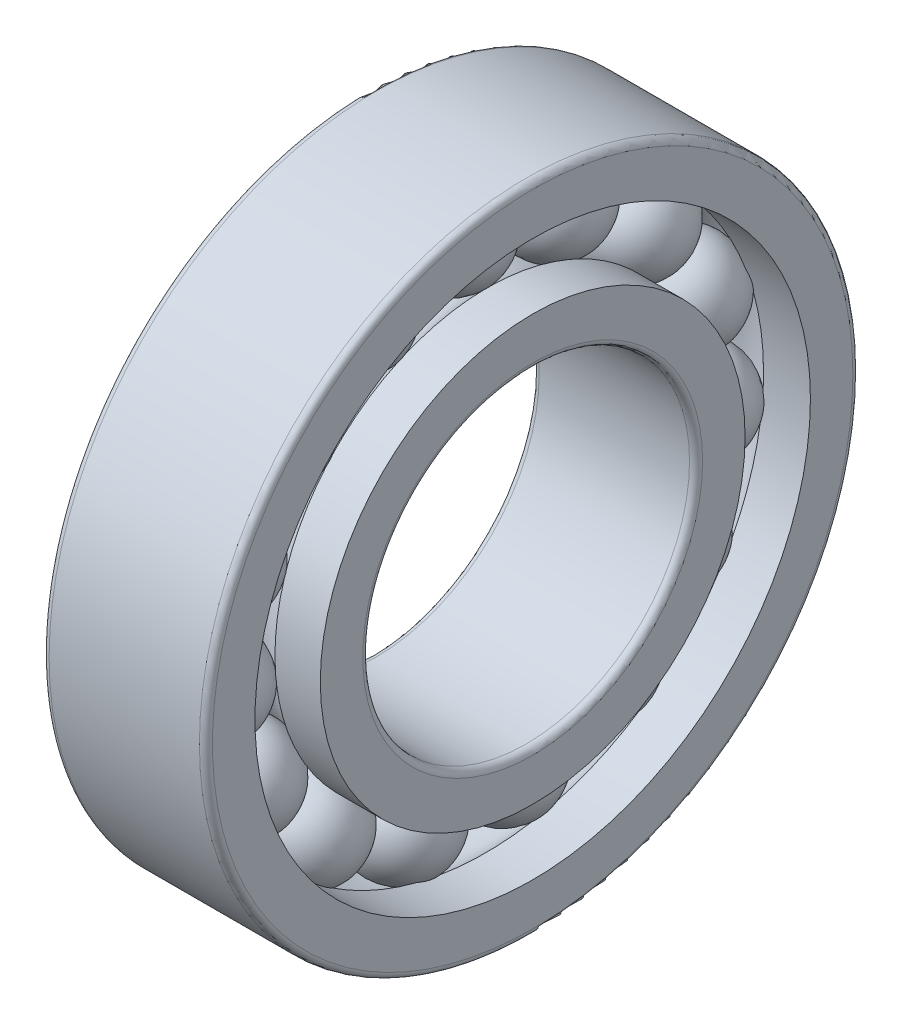
from build123d import *

# Parameters (mm, degrees)
CAGSPISKE_W         = 0.1905
CAGSPISKE_H         = 0.3175
CAGESPINE_ANGLE     = 0.001
BALLSDETAILED_COUNT = 15
BALLSDETAILED_ANGLE = 336


with BuildPart() as part:
    # CagSpiSke → CageSpine (revolve)
    with BuildSketch(Plane.XY):
        with Locations((0, 4.7625)):
            Rectangle(CAGSPISKE_W, CAGSPISKE_H)
    revolve(axis=Axis((-20.6375, 0, 0), (-1, 0, 0)), revolution_arc=CAGESPINE_ANGLE)

    # BalDetSke → BallDetailed (revolve)
    with BuildSketch(Plane.XY):
        with BuildLine():
            Line((-0.9525, 4.7625), (0.9525, 4.7625))
            ThreePointArc((0.9525, 4.7625), (0, 3.81), (-0.9525, 4.7625))
        make_face()
    balldetailed = revolve(axis=Axis((-1.905, 4.7625, 0), (1, 0, 0)))

    # InnRacSke → InnerRace (revolve)
    with BuildSketch(Plane.XY):
        with BuildLine():
            Line((-0.646040864, 4.1275), (-1.5875, 4.1275))
            Line((-1.5875, 4.1275), (-1.5875, 3.302))
            ThreePointArc((-1.5875, 3.302), (-1.550302561, 3.212197439), (-1.4605, 3.175))
            Line((-1.4605, 3.175), (1.4605, 3.175))
            ThreePointArc((1.4605, 3.175), (1.550302561, 3.212197439), (1.5875, 3.302))
            Line((1.5875, 3.302), (1.5875, 4.1275))
            Line((1.5875, 4.1275), (0.706040864, 4.1275))
            ThreePointArc((0.706040864, 4.1275), (0.03, 3.835), (-0.646040864, 4.1275))
        make_face()
    revolve(axis=Axis((-20.6375, 0, 0), (1, 0, 0)))

    # OutRacSke → OuterRace (revolve)
    with BuildSketch(Plane.XY):
        with BuildLine():
            Line((-0.676040864, 5.3975), (-1.5875, 5.3975))
            Line((-1.5875, 5.3975), (-1.5875, 6.223))
            ThreePointArc((-1.5875, 6.223), (-1.550302561, 6.312802561), (-1.4605, 6.35))
            Line((-1.4605, 6.35), (1.4605, 6.35))
            ThreePointArc((1.4605, 6.35), (1.550302561, 6.312802561), (1.5875, 6.223))
            Line((1.5875, 6.223), (1.5875, 5.3975))
            Line((1.5875, 5.3975), (0.676040864, 5.3975))
            ThreePointArc((0.676040864, 5.3975), (0, 5.69), (-0.676040864, 5.3975))
        make_face()
    revolve(axis=Axis((-20.6375, 0, 0), (1, 0, 0)))

    # BallsDetailed: BallDetailed ×15 about axis
    ballsdetailed_axis = Axis((-50, 0, 0), (1, 0, 0))
    for i in range(1, BALLSDETAILED_COUNT):
        add(balldetailed.rotate(ballsdetailed_axis, i * BALLSDETAILED_ANGLE / (BALLSDETAILED_COUNT - 1)))


solid = part.part
